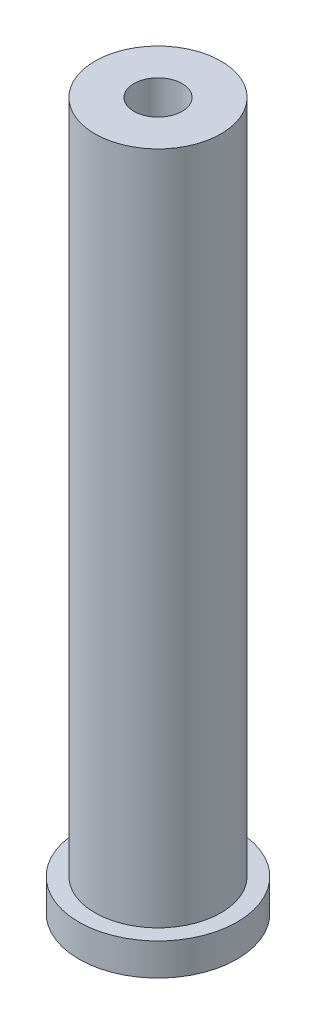
from build123d import *

# Parameters (mm, degrees)
SKIZZE1_R                       = 4.925
AUFSATZ_LINEAR_AUSTRAGEN1_DEPTH = 2
SKIZZE2_R                       = 3.925
AUFSATZ_LINEAR_AUSTRAGEN2_DEPTH = 42
SKIZZE3_R                       = 1.5
SCHNITT_LINEAR_AUSTRAGEN1_DEPTH = 15


with BuildPart() as part:
    # Skizze1 → Aufsatz-Linear austragen1 (new body)
    with BuildSketch(Plane(origin=(0, 0, 0), x_dir=(1, 0, 0), z_dir=(0, 1, 0))):
        Circle(SKIZZE1_R)
    extrude(amount=AUFSATZ_LINEAR_AUSTRAGEN1_DEPTH)

    # Skizze2 → Aufsatz-Linear austragen2 (add)
    with BuildSketch(Plane(origin=(0, 2, 0), x_dir=(1, 0, 0), z_dir=(0, 1, 0))):
        Circle(SKIZZE2_R)
    extrude(amount=AUFSATZ_LINEAR_AUSTRAGEN2_DEPTH)

    # Skizze3 → Schnitt-Linear austragen1 (cut)
    with BuildSketch(Plane(origin=(0, 44, 0), x_dir=(1, 0, 0), z_dir=(0, 1, 0))):
        Circle(SKIZZE3_R)
    extrude(amount=-SCHNITT_LINEAR_AUSTRAGEN1_DEPTH, mode=Mode.SUBTRACT)


solid = part.part
